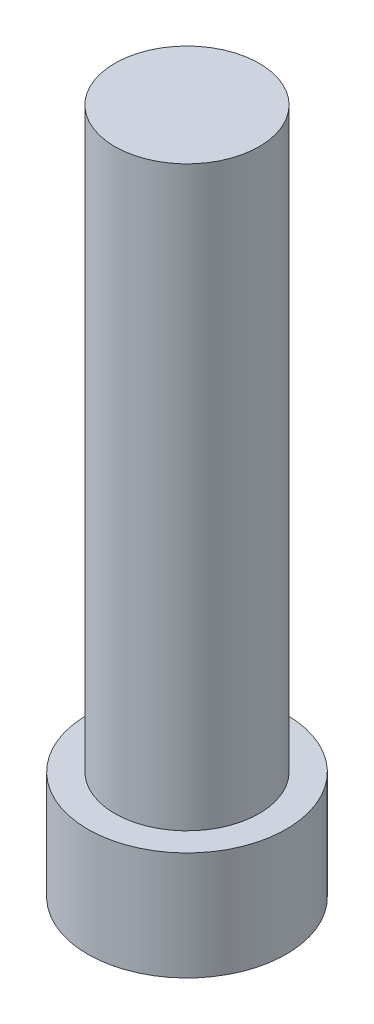
from build123d import *

# Parameters (mm, degrees)
SKETCH_1_R          = 2.75
EXTRUDE_1_DEPTH     = 3
SKETCH_2_R          = 2
EXTRUDE_2_DEPTH     = 16
CUT_EXTRUDE_1_DEPTH = 1.5


with BuildPart() as part:
    # 草图1 → 凸台-拉伸1 (new body)
    with BuildSketch(Plane(origin=(0, 0, 0), x_dir=(1, 0, 0), z_dir=(0, 1, 0))):
        Circle(SKETCH_1_R)
    extrude(amount=EXTRUDE_1_DEPTH)

    # 草图2 → 凸台-拉伸2 (add)
    with BuildSketch(Plane(origin=(0, 3, 0), x_dir=(1, 0, 0), z_dir=(0, 1, 0))):
        Circle(SKETCH_2_R)
    extrude(amount=EXTRUDE_2_DEPTH)

    # 草图3 → 切除-拉伸1 (cut)
    with BuildSketch(Plane.XZ):
        Polygon((1.091681609, -0.944226984), (1.36356536, 0.473310514), (0.271883751, 1.417537498), (-1.091681609, 0.944226984), (-1.36356536, -0.473310514), (-0.271883751, -1.417537498), align=None)
    extrude(amount=-CUT_EXTRUDE_1_DEPTH, mode=Mode.SUBTRACT)


solid = part.part
